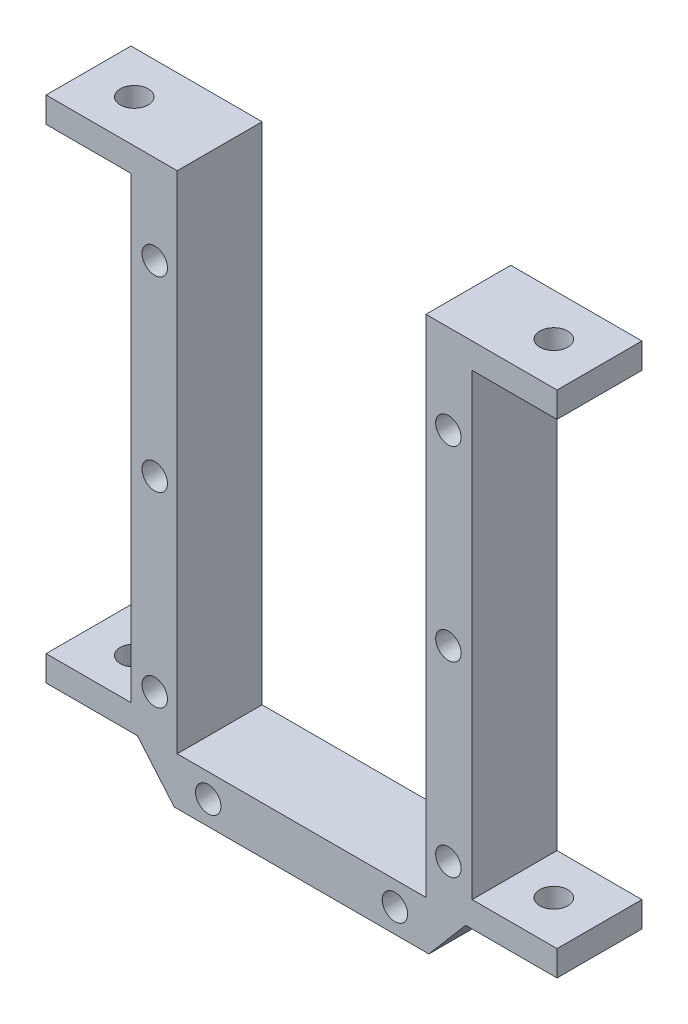
from build123d import *

# Parameters (mm, degrees)
SKETCH1_W           = 40.2
SKETCH1_H           = 65.1
BOSS_EXTRUDE1_DEPTH = 10
CUT_EXTRUDE1_DEPTH  = 10
SKETCH4_W           = 29.3
SKETCH4_H           = 59.5
CUT_EXTRUDE2_DEPTH  = 10
SKETCH5_R           = 1.5
CUT_EXTRUDE3_DEPTH  = 10
SKETCH7_W           = 10
SKETCH7_H           = 3
BOSS_EXTRUDE2_DEPTH = 10
SKETCH8_W           = 10
SKETCH8_H           = 3
BOSS_EXTRUDE3_DEPTH = 10
SKETCH9_R           = 1.65
CUT_EXTRUDE4_DEPTH  = 68.867591677
SKETCH10_R          = 1.65
CUT_EXTRUDE5_DEPTH  = 68.867591677


with BuildPart() as part:
    # Sketch1 → Boss-Extrude1 (new body)
    with BuildSketch(Plane.XY):
        Rectangle(SKETCH1_W, SKETCH1_H)
    extrude(amount=BOSS_EXTRUDE1_DEPTH)

    # Sketch2 → Cut-Extrude1 (cut)
    with BuildSketch(Plane.XY.offset(10)):
        Polygon((15, -32.55), (19.335, -27.45), (20.1, -27.45), (20.1, -32.55), align=None)
        Polygon((-20.1, -27.45), (-20.1, -32.55), (-15, -32.55), (-19.335, -27.45), align=None)
    extrude(amount=-CUT_EXTRUDE1_DEPTH, mode=Mode.SUBTRACT)

    # Sketch4 → Cut-Extrude2 (cut)
    with BuildSketch(Plane.XY.offset(10)):
        with Locations((0, 2.8)):
            Rectangle(SKETCH4_W, SKETCH4_H)
    extrude(amount=-CUT_EXTRUDE2_DEPTH, mode=Mode.SUBTRACT)

    # Sketch5 → Cut-Extrude3 (cut)
    with BuildSketch(Plane.XY.offset(10)):
        with Locations((-17.3, 22.05)):
            Circle(SKETCH5_R)
        with Locations((-17.3, 0.05)):
            Circle(SKETCH5_R)
        with Locations((-17.3, -21.95)):
            Circle(SKETCH5_R)
        with Locations((-11, -29.75)):
            Circle(SKETCH5_R)
        with Locations((11, -29.75)):
            Circle(SKETCH5_R)
        with Locations((17.3, -21.95)):
            Circle(SKETCH5_R)
        with Locations((17.3, 0.05)):
            Circle(SKETCH5_R)
        with Locations((17.3, 22.05)):
            Circle(SKETCH5_R)
    extrude(amount=-CUT_EXTRUDE3_DEPTH, mode=Mode.SUBTRACT)

    # Sketch7 → Boss-Extrude2 (add)
    with BuildSketch(Plane(origin=(20.1, 0, 0), x_dir=(0, 0, -1), z_dir=(1, 0, 0))):
        with Locations((-5, 31.05)):
            Rectangle(SKETCH7_W, SKETCH7_H)
        with Locations((-5, -25.95)):
            Rectangle(SKETCH7_W, SKETCH7_H)
    extrude(amount=BOSS_EXTRUDE2_DEPTH)

    # Sketch8 → Boss-Extrude3 (add)
    with BuildSketch(Plane.ZY.offset(20.1)):
        with Locations((5, 31.05)):
            Rectangle(SKETCH8_W, SKETCH8_H)
        with Locations((5, -25.95)):
            Rectangle(SKETCH8_W, SKETCH8_H)
    extrude(amount=BOSS_EXTRUDE3_DEPTH)

    # Sketch9 → Cut-Extrude4 (cut, through all)
    with BuildSketch(Plane(origin=(0, -27.45, 0), x_dir=(-1, 0, 0), z_dir=(0, -1, 0))):
        with Locations((24.7175, -5)):
            Circle(SKETCH9_R)
    extrude(amount=-CUT_EXTRUDE4_DEPTH, mode=Mode.SUBTRACT)

    # Sketch10 → Cut-Extrude5 (cut, through all)
    with BuildSketch(Plane(origin=(0, -27.45, 0), x_dir=(-1, 0, 0), z_dir=(0, -1, 0))):
        with Locations((-24.7175, -5)):
            Circle(SKETCH10_R)
    extrude(amount=-CUT_EXTRUDE5_DEPTH, mode=Mode.SUBTRACT)


solid = part.part
